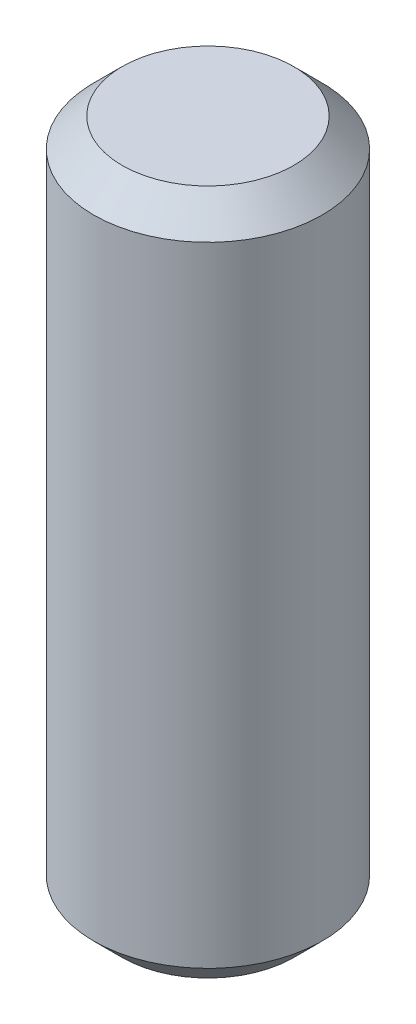
from build123d import *

# Parameters (mm, degrees)
SKETCH2_R           = 2
BOSS_EXTRUDE1_DEPTH = 12
CHAMFER1_SIZE       = 0.5


with BuildPart() as part:
    # Sketch2 → Boss-Extrude1 (new body)
    with BuildSketch(Plane(origin=(0, 0, 0), x_dir=(1, 0, 0), z_dir=(0, 1, 0))):
        Circle(SKETCH2_R)
    extrude(amount=BOSS_EXTRUDE1_DEPTH)

    # Chamfer1
    chamfer1_edges = [part.edges().sort_by_distance(p)[0] for p in [
        (-2, 0, 0),
        (-2, 12, 0),
    ]]
    chamfer(chamfer1_edges, length=CHAMFER1_SIZE)


solid = part.part
